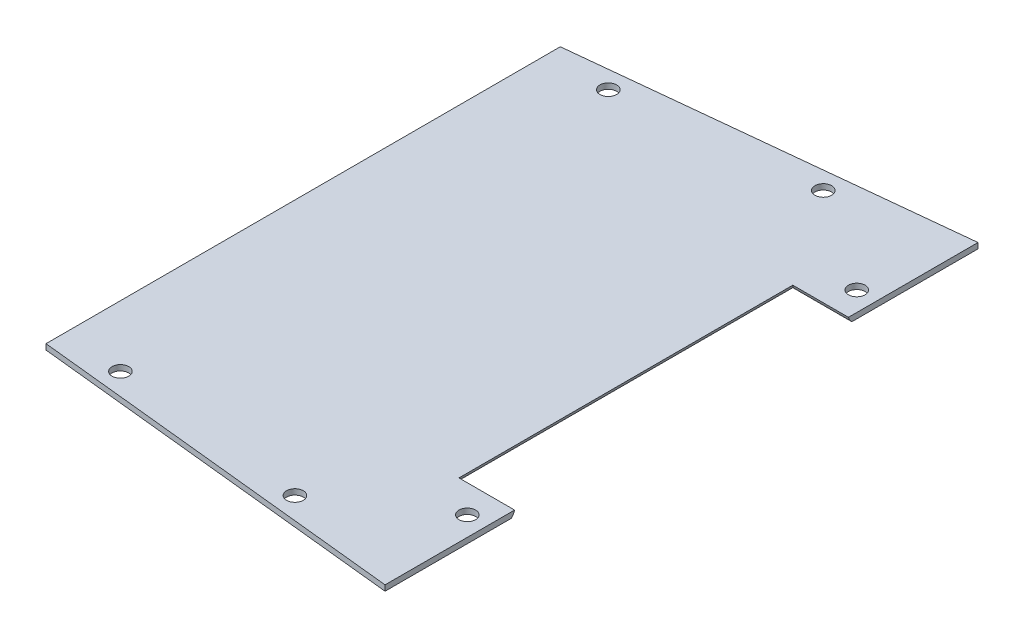
from build123d import *

# Parameters (mm, degrees)
EXTRUDE_1_DEPTH     = 1
CUT_EXTRUDE_1_REACH = 65.213
SKETCH_3_R          = 1.5
EXTRUDE_2_DEPTH     = 0.5
FILLET_1_R          = 2


with BuildPart() as part:
    # 스케치2 → 보스-돌출1 (new body)
    with BuildSketch(Plane(origin=(0, 0, 0), x_dir=(1, 0, 0), z_dir=(0, 1, 0))):
        Polygon((34, 30), (34, 53.281300489), (-34, 46.211993558), (-34, -46.211993558), (34, -53.281300489), (34, -30), (24, -30), (24, 30), align=None)
    extrude(amount=EXTRUDE_1_DEPTH)

    # 스케치3 → 컷-돌출1 (cut, up to next)
    with BuildSketch(Plane.XZ, mode=Mode.PRIVATE) as cut_extrude_1_sk1:
        with Locations(Location((-23, 43.836695157, 0), (0, 0, 270))):
            Circle(SKETCH_3_R)
    cut_extrude_1_tool1 = extrude(cut_extrude_1_sk1.sketch, amount=-CUT_EXTRUDE_1_REACH, mode=Mode.PRIVATE) & part.part
    # 스케치3 → 컷-돌출1 (cut, up to next)
    with BuildSketch(Plane.XZ, mode=Mode.PRIVATE) as cut_extrude_1_sk2:
        with Locations(Location((12, 47.475309018, 0), (0, 0, 270))):
            Circle(SKETCH_3_R)
    cut_extrude_1_tool2 = extrude(cut_extrude_1_sk2.sketch, amount=-CUT_EXTRUDE_1_REACH, mode=Mode.PRIVATE) & part.part
    # 스케치3 → 컷-돌출1 (cut, up to next)
    with BuildSketch(Plane.XZ, mode=Mode.PRIVATE) as cut_extrude_1_sk3:
        with Locations(Location((30.5, 35, 0), (0, 0, 270))):
            Circle(SKETCH_3_R)
    cut_extrude_1_tool3 = extrude(cut_extrude_1_sk3.sketch, amount=-CUT_EXTRUDE_1_REACH, mode=Mode.PRIVATE) & part.part
    # 스케치3 → 컷-돌출1 (cut, up to next)
    with BuildSketch(Plane.XZ, mode=Mode.PRIVATE) as cut_extrude_1_sk4:
        with Locations(Location((30.5, -35, 0), (0, 0, 270))):
            Circle(SKETCH_3_R)
    cut_extrude_1_tool4 = extrude(cut_extrude_1_sk4.sketch, amount=-CUT_EXTRUDE_1_REACH, mode=Mode.PRIVATE) & part.part
    # 스케치3 → 컷-돌출1 (cut, up to next)
    with BuildSketch(Plane.XZ, mode=Mode.PRIVATE) as cut_extrude_1_sk5:
        with Locations(Location((-23, -43.836695157, 0), (0, 0, 270))):
            Circle(SKETCH_3_R)
    cut_extrude_1_tool5 = extrude(cut_extrude_1_sk5.sketch, amount=-CUT_EXTRUDE_1_REACH, mode=Mode.PRIVATE) & part.part
    # 스케치3 → 컷-돌출1 (cut, up to next)
    with BuildSketch(Plane.XZ, mode=Mode.PRIVATE) as cut_extrude_1_sk6:
        with Locations(Location((12, -47.475309018, 0), (0, 0, 270))):
            Circle(SKETCH_3_R)
    cut_extrude_1_tool6 = extrude(cut_extrude_1_sk6.sketch, amount=-CUT_EXTRUDE_1_REACH, mode=Mode.PRIVATE) & part.part
    add(cut_extrude_1_tool1.solids().sort_by_distance((-23, 0, 43.836695))[0], mode=Mode.SUBTRACT)
    add(cut_extrude_1_tool2.solids().sort_by_distance((12, 0, 47.475309))[0], mode=Mode.SUBTRACT)
    add(cut_extrude_1_tool3.solids().sort_by_distance((30.5, 0, 35))[0], mode=Mode.SUBTRACT)
    add(cut_extrude_1_tool4.solids().sort_by_distance((30.5, 0, -35))[0], mode=Mode.SUBTRACT)
    add(cut_extrude_1_tool5.solids().sort_by_distance((-23, 0, -43.836695))[0], mode=Mode.SUBTRACT)
    add(cut_extrude_1_tool6.solids().sort_by_distance((12, 0, -47.475309))[0], mode=Mode.SUBTRACT)

    # 스케치4 → 보스-돌출2 (add)
    with BuildSketch(Plane.XZ):
        with BuildLine():
            Line((-34, 44.000136968), (-34, -44.000136968))
            Line((-34, -44.000136968), (-25.869682763, -44.845367968))
            Line((-25.869682763, -44.845367968), (-25.735258708, -43.552336579))
            ThreePointArc((-25.735258708, -43.552336579), (-22.715641421, -41.101436449), (-20.264741292, -44.121053736))
            Line((-20.264741292, -44.121053736), (-20.399165347, -45.414085125))
            Line((-20.399165347, -45.414085125), (9.130317237, -48.483981829))
            Line((9.130317237, -48.483981829), (9.264741292, -47.19095044))
            ThreePointArc((9.264741292, -47.19095044), (12.284358579, -44.740050311), (14.735258708, -47.759667597))
            Line((14.735258708, -47.759667597), (14.600834653, -49.052698986))
            Line((14.600834653, -49.052698986), (31.8, -50.840731027))
            Line((31.8, -50.840731027), (31.8, -37.75))
            Line((31.8, -37.75), (30.5, -37.75))
            ThreePointArc((30.5, -37.75), (27.75, -35), (30.5, -32.25))
            Line((30.5, -32.25), (31.8, -32.25))
            Line((31.8, -32.25), (31.8, -30))
            Line((31.8, -30), (24, -30))
            Line((24, -30), (24, 30))
            Line((24, 30), (31.8, 30))
            Line((31.8, 30), (31.8, 32.25))
            Line((31.8, 32.25), (30.5, 32.25))
            ThreePointArc((30.5, 32.25), (27.75, 35), (30.5, 37.75))
            Line((30.5, 37.75), (31.8, 37.75))
            Line((31.8, 37.75), (31.8, 50.840731027))
            Line((31.8, 50.840731027), (14.600834653, 49.052698986))
            Line((14.600834653, 49.052698986), (14.735258708, 47.759667597))
            ThreePointArc((14.735258708, 47.759667597), (12.284358579, 44.740050311), (9.264741292, 47.19095044))
            Line((9.264741292, 47.19095044), (9.130317237, 48.483981829))
            Line((9.130317237, 48.483981829), (-20.399165347, 45.414085125))
            Line((-20.399165347, 45.414085125), (-20.264741292, 44.121053736))
            ThreePointArc((-20.264741292, 44.121053736), (-22.715641421, 41.101436449), (-25.735258708, 43.552336579))
            Line((-25.735258708, 43.552336579), (-25.869682763, 44.845367968))
            Line((-25.869682763, 44.845367968), (-34, 44.000136968))
        make_face()
    extrude(amount=EXTRUDE_2_DEPTH)

    # 필렛1
    # the kernel refuses this fillet: 2 mm, written as the material it takes off along each edge
    with BuildSketch(Plane(origin=(36.641229183, -0.5, -30), x_dir=(0, 0, -1), z_dir=(-1, 0, 0)), Plane(origin=(24, -0.5, 30), x_dir=(0, 0, 1), z_dir=(1, 0, 0))) as fillet_1_piece_1:
        with BuildLine():
            CenterArc((1.936491673, -2), FILLET_1_R, 90, 75.522487814)
            Line((0, -1.5), (-0.038729833, -1.49))
            ThreePointArc((-0.038729833, -1.49), (-0.04, -0.75), (-0.04, 0))
            Line((-0.04, 0), (0, 0.04))
            Line((0, 0.04), (1.936491673, 0.04))
            Line((1.936491673, 0.04), (1.936491673, 0))
        make_face()
    extrude(amount=12.641229183, mode=Mode.SUBTRACT)
    with BuildSketch(Plane(origin=(24, -0.5, -30), x_dir=(-1, 0, 0), z_dir=(0, 0, 1))) as fillet_1_piece_2:
        with BuildLine():
            CenterArc((1.936491673, -2), FILLET_1_R, 90, 75.522487814)
            Line((0, -1.5), (-0.038729833, -1.49))
            ThreePointArc((-0.038729833, -1.49), (-0.04, -0.75), (-0.04, 0))
            Line((-0.04, 0), (0, 0.04))
            Line((0, 0.04), (1.936491673, 0.04))
            Line((1.936491673, 0.04), (1.936491673, 0))
        make_face()
    extrude(amount=60, mode=Mode.SUBTRACT)
    with BuildSketch(Plane(origin=(36.641229183, -0.5, -30), x_dir=(0, 0, -1), z_dir=(-1, 0, 0))) as fillet_1_piece_3a_section:
        with BuildLine():
            CenterArc((1.936491673, -2), FILLET_1_R, 90, 75.522487814)
            Line((0, -1.5), (-0.038729833, -1.49))
            ThreePointArc((-0.038729833, -1.49), (-0.04, -0.75), (-0.04, 0))
            Line((-0.04, 0), (0, 0.04))
            Line((0, 0.04), (1.936491673, 0.04))
            Line((1.936491673, 0.04), (1.936491673, 0))
        make_face()
    fillet_1_piece_3a = extrude(amount=17.482458366, mode=Mode.PRIVATE)
    fillet_1_piece_3a = split(fillet_1_piece_3a, bisect_by=Plane(origin=(24, -0.120816489, -30.456288202), z_dir=(-1, 0, 0)), keep=Keep.TOP, mode=Mode.PRIVATE)
    with BuildSketch(Plane(origin=(24, -0.5, -34.841229183), x_dir=(-1, 0, 0), z_dir=(0, 0, 1))) as fillet_1_piece_3b_section:
        with BuildLine():
            CenterArc((1.936491673, -2), FILLET_1_R, 90, 75.522487814)
            Line((0, -1.5), (-0.038729833, -1.49))
            ThreePointArc((-0.038729833, -1.49), (-0.04, -0.75), (-0.04, 0))
            Line((-0.04, 0), (0, 0.04))
            Line((0, 0.04), (1.936491673, 0.04))
            Line((1.936491673, 0.04), (1.936491673, 0))
        make_face()
    fillet_1_piece_3b = extrude(amount=64.841229183, mode=Mode.PRIVATE)
    fillet_1_piece_3b = split(fillet_1_piece_3b, bisect_by=Plane(origin=(23.543711798, -0.120816489, -30), z_dir=(0, 0, -1)), keep=Keep.TOP, mode=Mode.PRIVATE)
    fillet_1_piece_3 = fillet_1_piece_3a & fillet_1_piece_3b
    add(fillet_1_piece_3, mode=Mode.SUBTRACT)
    with BuildSketch(Plane(origin=(24, -0.5, -30), x_dir=(-1, 0, 0), z_dir=(0, 0, 1))) as fillet_1_piece_4a_section:
        with BuildLine():
            CenterArc((1.936491673, -2), FILLET_1_R, 90, 75.522487814)
            Line((0, -1.5), (-0.038729833, -1.49))
            ThreePointArc((-0.038729833, -1.49), (-0.04, -0.75), (-0.04, 0))
            Line((-0.04, 0), (0, 0.04))
            Line((0, 0.04), (1.936491673, 0.04))
            Line((1.936491673, 0.04), (1.936491673, 0))
        make_face()
    fillet_1_piece_4a = extrude(amount=64.841229183, mode=Mode.PRIVATE)
    fillet_1_piece_4a = split(fillet_1_piece_4a, bisect_by=Plane(origin=(23.543711798, -0.120816489, 30), z_dir=(0, 0, 1)), keep=Keep.TOP, mode=Mode.PRIVATE)
    with BuildSketch(Plane(origin=(19.158770817, -0.5, 30), x_dir=(0, 0, 1), z_dir=(1, 0, 0))) as fillet_1_piece_4b_section:
        with BuildLine():
            CenterArc((1.936491673, -2), FILLET_1_R, 90, 75.522487814)
            Line((0, -1.5), (-0.038729833, -1.49))
            ThreePointArc((-0.038729833, -1.49), (-0.04, -0.75), (-0.04, 0))
            Line((-0.04, 0), (0, 0.04))
            Line((0, 0.04), (1.936491673, 0.04))
            Line((1.936491673, 0.04), (1.936491673, 0))
        make_face()
    fillet_1_piece_4b = extrude(amount=17.482458366, mode=Mode.PRIVATE)
    fillet_1_piece_4b = split(fillet_1_piece_4b, bisect_by=Plane(origin=(24, -0.120816489, 30.456288202), z_dir=(-1, 0, 0)), keep=Keep.TOP, mode=Mode.PRIVATE)
    fillet_1_piece_4 = fillet_1_piece_4a & fillet_1_piece_4b
    add(fillet_1_piece_4, mode=Mode.SUBTRACT)


solid = part.part
